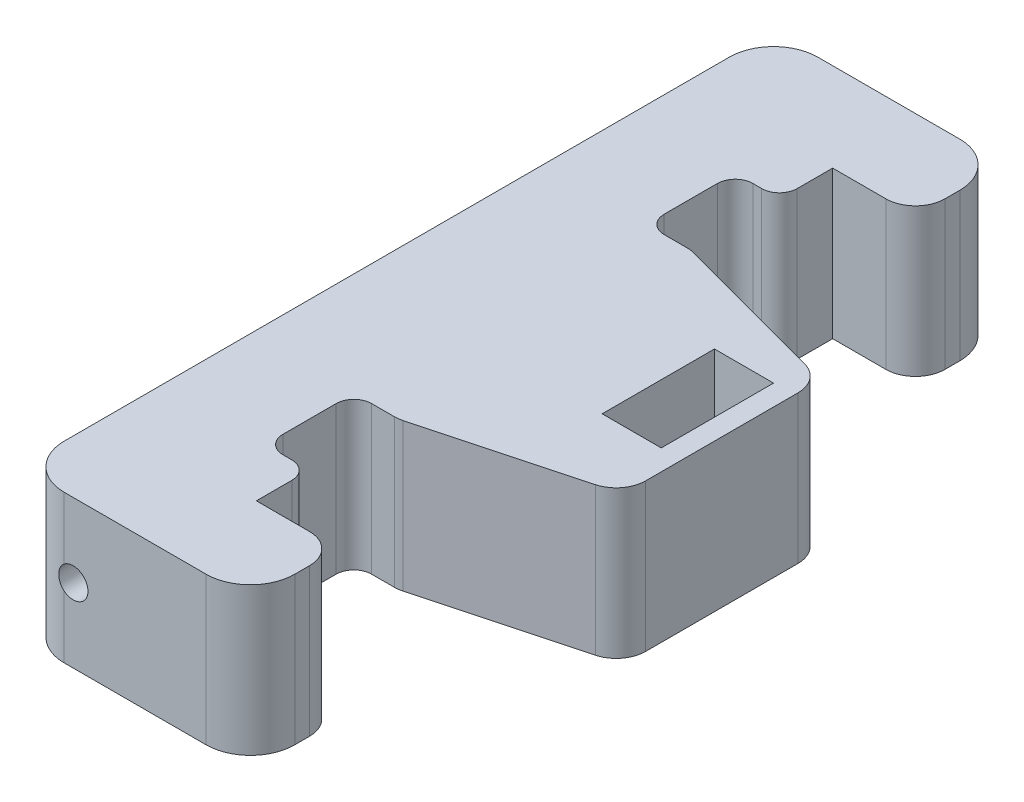
from build123d import *

# Parameters (mm, degrees)
BOSS_EXTRUDE1_DEPTH = 12.7
CUT_EXTRUDE1_DEPTH  = 38.486519244
FILLET4_R           = 1.524
FILLET5_R           = 3.81
SKETCH3_R           = 1.27
CUT_EXTRUDE2_DEPTH  = 68.465574925
SKETCH4_W           = 5.08
SKETCH4_H           = 9.652
CUT_EXTRUDE3_DEPTH  = 38.486519401
FILLET6_R           = 2.54
FILLET7_R           = 2.54


with BuildPart() as part:
    # Sketch1 → Boss-Extrude1 (new body)
    with BuildSketch(Plane(origin=(0, 0, 0), x_dir=(1, 0, 0), z_dir=(0, 1, 0))):
        Polygon((5.842, 32.385), (-13.97, 32.385), (-13.97, -32.385), (5.842, -32.385), (5.842, -24.765), (-1.27, -24.765), (-1.27, -20.193), (-5.08, -20.193), (-5.08, -12.573), (-1.27, -12.573), (5.842, -12.573), (13.97, -12.573), (13.97, 12.573), (5.842, 12.573), (-1.27, 12.573), (-5.08, 12.573), (-5.08, 20.193), (-1.27, 20.193), (-1.27, 24.765), (5.842, 24.765), align=None)
    extrude(amount=BOSS_EXTRUDE1_DEPTH)

    # Sketch2 → Cut-Extrude1 (cut, through all)
    with BuildSketch(Plane(origin=(0, 12.7, 0), x_dir=(1, 0, 0), z_dir=(0, 1, 0))):
        Polygon((-1.27, 12.573), (13.97, 8.489454307), (13.97, 12.573), align=None)
        Polygon((-1.27, -12.573), (13.97, -8.489454307), (13.97, -12.573), align=None)
    extrude(amount=-CUT_EXTRUDE1_DEPTH, mode=Mode.SUBTRACT)

    # Fillet4
    fillet4_edges = [part.edges().sort_by_distance(p)[0] for p in [
        (-1.27, 6.35, 20.193),
        (-5.08, 6.35, 20.193),
        (-5.08, 6.35, 12.573),
        (-5.08, 6.35, -12.573),
        (-5.08, 6.35, -20.193),
        (-1.27, 6.35, -20.193),
    ]]
    fillet(fillet4_edges, radius=FILLET4_R)

    # Fillet5
    fillet5_edges = [part.edges().sort_by_distance(p)[0] for p in [
        (-13.97, 6.35, 32.385),
        (-13.97, 6.35, -32.385),
        (5.842, 6.35, -32.385),
        (5.842, 6.35, 32.385),
    ]]
    fillet(fillet5_edges, radius=FILLET5_R)

    # Sketch3 → Cut-Extrude2 (cut, through all)
    with BuildSketch(Plane.XY.offset(32.385)):
        with Locations((-9.391956596, 6.35)):
            Circle(SKETCH3_R)
    extrude(amount=-CUT_EXTRUDE2_DEPTH, mode=Mode.SUBTRACT)

    # Sketch4 → Cut-Extrude3 (cut, through all)
    with BuildSketch(Plane(origin=(0, 12.7, 0), x_dir=(1, 0, 0), z_dir=(0, 1, 0))):
        with Locations((9.652, 1.397)):
            Rectangle(SKETCH4_W, SKETCH4_H)
    extrude(amount=-CUT_EXTRUDE3_DEPTH, mode=Mode.SUBTRACT)

    # Fillet6
    fillet6_edges = [part.edges().sort_by_distance(p)[0] for p in [
        (-1.27, 6.35, 12.573),
        (-1.27, 6.35, -12.573),
        (13.97, 6.35, 8.489454307),
        (13.97, 6.35, -8.489454307),
    ]]
    fillet(fillet6_edges, radius=FILLET6_R)

    # Fillet7
    fillet7_edges = [part.edges().sort_by_distance(p)[0] for p in [
        (5.842, 6.35, -24.765),
        (5.842, 6.35, 24.765),
    ]]
    fillet(fillet7_edges, radius=FILLET7_R)


solid = part.part
